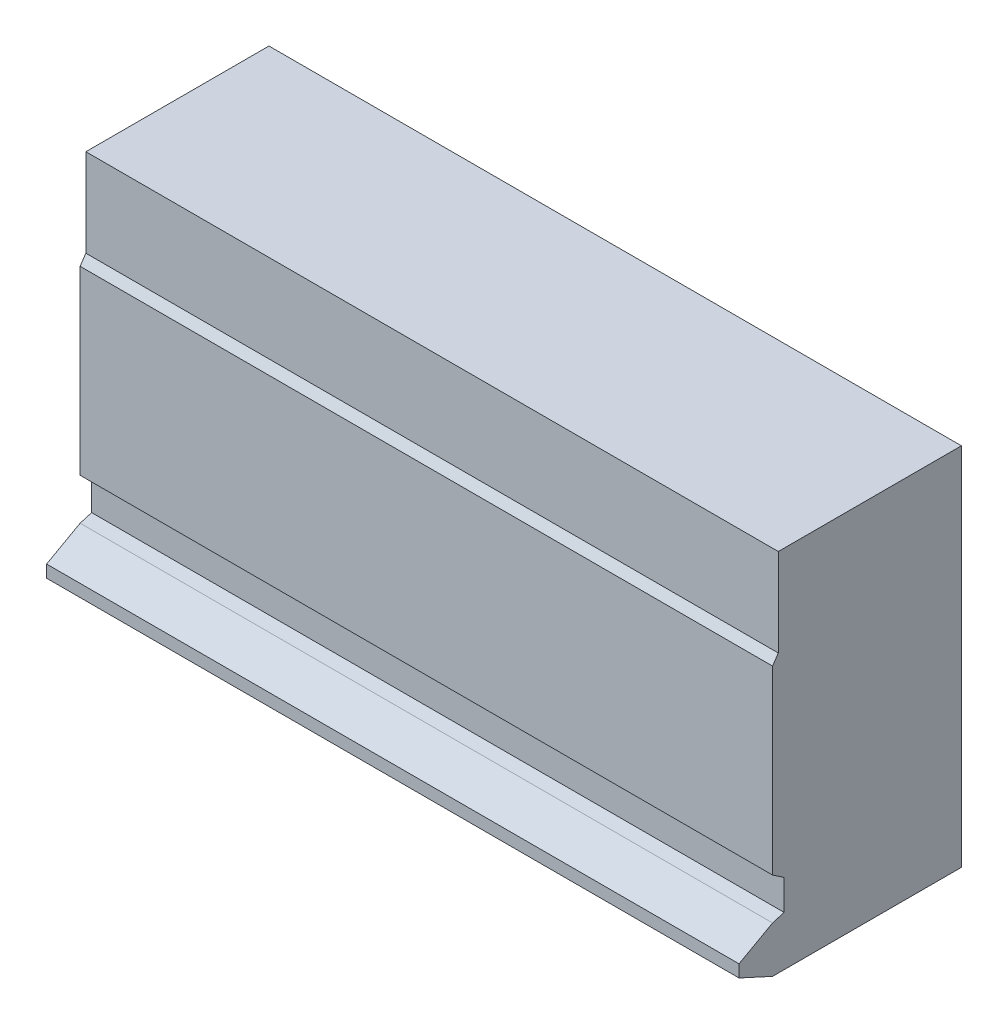
from build123d import *

# Parameters (mm, degrees)
SKETCH1_W           = 110
SKETCH1_H           = 58
BOSS_EXTRUDE1_DEPTH = 30
BOSS_EXTRUDE2_DEPTH = 110
CUT_EXTRUDE1_DEPTH  = 110


with BuildPart() as part:
    # Sketch1 → Boss-Extrude1 (new body)
    with BuildSketch(Plane.XY):
        with Locations((7.079207921, 0.514851485)):
            Rectangle(SKETCH1_W, SKETCH1_H)
    extrude(amount=BOSS_EXTRUDE1_DEPTH)

    # Sketch2 → Boss-Extrude2 (add)
    with BuildSketch(Plane.ZY.offset(47.920792079)):
        Polygon((30, -21.137098588), (35.325298797, -24.090775014), (35.325298797, -26.043205194), (30, -28.485148515), align=None)
    extrude(amount=-BOSS_EXTRUDE2_DEPTH)

    # Sketch3 → Cut-Extrude1 (cut)
    with BuildSketch(Plane.ZY.offset(47.920792079)):
        Polygon((30, -21.137098588), (28.175734983, -20.586413153), (28.175734983, -15.780431171), (30, -14.543139374), (30, 14.206893901), (29.087867492, 15.55174354), (29.087867492, 31.828827834), (32.731405403, 31.828827834), (32.731405403, -21.137098588), align=None)
    extrude(amount=-CUT_EXTRUDE1_DEPTH, mode=Mode.SUBTRACT)


solid = part.part
